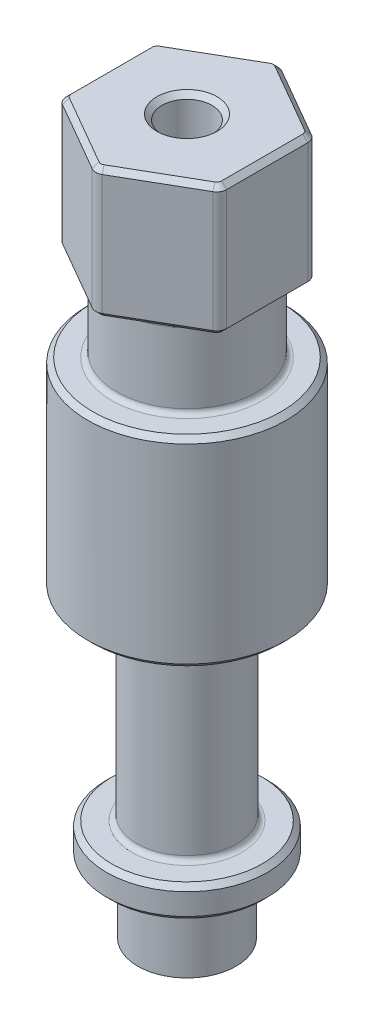
from build123d import *

# Parameters (mm, degrees)
CHAMFER1_SIZE       = 0.25
FILLET1_R           = 0.25
BOSS_EXTRUDE1_DEPTH = 6.5
CUT_EXTRUDE1_REACH  = 38.252
SKETCH3_R           = 1.25
FILLET2_R           = 0.5
FILLET3_R           = 0.25
CHAMFER2_SIZE       = 0.25


with BuildPart() as part:
    # Sketch1 → Revolve1 (revolve)
    with BuildSketch(Plane.XY):
        Polygon((0, 29.07), (3.5, 29.07), (3.5, 25.07), (4.95, 25.07), (4.95, 15.07), (2.5, 15.07), (2.5, 5.07), (4, 5.07), (4, 3.5), (2.45, 3.5), (2.45, 0), (0, 0), align=None)
    revolve(axis=Axis((0, -485.856754354, 0), (0, 1, 0)))

    # Chamfer1
    chamfer1_edges = [part.edges().sort_by_distance(p)[0] for p in [
        (-4, 3.5, 0),
        (-4, 5.07, 0),
        (-4.95, 15.07, 0),
        (-4.95, 25.07, 0),
    ]]
    chamfer(chamfer1_edges, length=CHAMFER1_SIZE)

    # Fillet1
    fillet1_edges = [part.edges().sort_by_distance(p)[0] for p in [
        (-2.45, 3.5, 0),
        (-2.5, 5.07, 0),
        (-2.5, 15.07, 0),
        (-3.5, 25.07, 0),
    ]]
    fillet(fillet1_edges, radius=FILLET1_R)

    # Sketch2 → Boss-Extrude1 (add)
    with BuildSketch(Plane(origin=(0, 29.07, 0), x_dir=(1, 0, 0), z_dir=(0, 1, 0))):
        Polygon((4, 2.309401077), (0, 4.618802154), (-4, 2.309401077), (-4, -2.309401077), (0, -4.618802154), (4, -2.309401077), align=None)
    extrude(amount=BOSS_EXTRUDE1_DEPTH)

    # Sketch3 → Cut-Extrude1 (cut, up to next)
    with BuildSketch(Plane(origin=(0, 35.57, 0), x_dir=(1, 0, 0), z_dir=(0, 1, 0)), mode=Mode.PRIVATE) as cut_extrude1_sk1:
        with Locations(Location((0, 0, 0), (0, 0, 180))):
            Circle(SKETCH3_R)
    cut_extrude1_tool1 = extrude(cut_extrude1_sk1.sketch, amount=-CUT_EXTRUDE1_REACH, mode=Mode.PRIVATE) & part.part
    add(cut_extrude1_tool1.solids().sort_by_distance((0, 35.57, 0))[0], mode=Mode.SUBTRACT)

    # Fillet2
    fillet2_edges = [part.edges().sort_by_distance(p)[0] for p in [
        (4, 32.32, 2.309401077),
        (4, 32.32, -2.309401077),
        (0, 32.32, -4.618802154),
        (-4, 32.32, -2.309401077),
        (-4, 32.32, 2.309401077),
        (0, 32.32, 4.618802154),
    ]]
    fillet(fillet2_edges, radius=FILLET2_R)

    # Fillet3
    fillet3_edges = [part.edges().sort_by_distance(p)[0] for p in [
        (-3.5, 29.07, 0),
    ]]
    fillet(fillet3_edges, radius=FILLET3_R)

    # Chamfer2
    chamfer2_edges = [part.edges().sort_by_distance(p)[0] for p in [
        (1.25, 35.57, 0),
        (-2, 29.07, -3.464101615),
        (-2, 35.57, -3.464101615),
        (4, 29.07, 0),
        (2, 29.07, 3.464101615),
        (-2, 29.07, 3.464101615),
        (-4, 29.07, 0),
        (2, 29.07, -3.464101615),
        (0, 29.07, 4.541451884),
        (-3.933012702, 29.07, 2.270725942),
        (3.933012702, 29.07, 2.270725942),
        (3.933012702, 29.07, -2.270725942),
        (-3.933012702, 29.07, -2.270725942),
        (0, 29.07, -4.541451884),
        (2, 35.57, -3.464101615),
        (4, 35.57, 0),
        (-4, 35.57, 0),
        (-2, 35.57, 3.464101615),
        (2, 35.57, 3.464101615),
        (0, 35.57, 4.541451884),
        (-3.933012702, 35.57, 2.270725942),
        (3.933012702, 35.57, 2.270725942),
        (3.933012702, 35.57, -2.270725942),
        (-3.933012702, 35.57, -2.270725942),
        (0, 35.57, -4.541451884),
    ]]
    chamfer(chamfer2_edges, length=CHAMFER2_SIZE - 0.0001)  # a hair under: the kernel refuses the full size


solid = part.part
